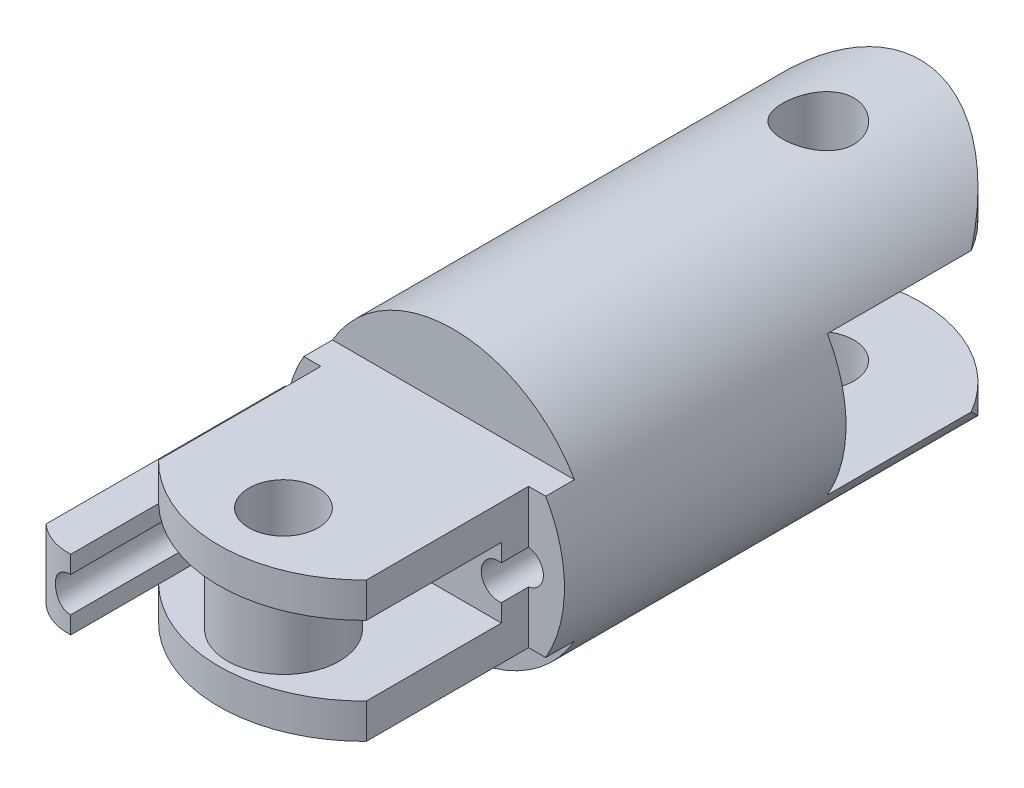
from build123d import *
from build123d.topology import SkipClean

# Parameters (mm, degrees)
SKETCH2_R                       = 10
PHALANGE_LENGTH_DEPTH           = 22.1
BOSS_EXTRUDE3_DEPTH             = 5
BOSS_EXTRUDE4_DEPTH             = 5
BOSS_EXTRUDE4_DEPTH_BACK        = 5
CUT_EXTRUDE2_START              = -15.3025
CUT_EXTRUDE2_DEPTH              = 15.3025
SKETCH7_R                       = 1.65
CUT_EXTRUDE3_DEPTH              = 10
CUT_EXTRUDE4_DEPTH              = 2.5
CUT_EXTRUDE4_DEPTH_BACK         = 2.5
CUT_EXTRUDE7_REACH              = 43.565
SKETCH4_R                       = 1.65
CUT_EXTRUDE7_DIRECTION_2_REACH  = 43.565
CUT_EXTRUDE_THIN1_START         = 22.1
CUT_EXTRUDE_THIN1_DEPTH         = 10.361670454
BOSS_EXTRUDE5_REACH             = 42.73
SKETCH9_R                       = 4
SKETCH9_R_2                     = 1.65
CUT_EXTRUDE8_REACH              = 41.987
SKETCH10_R                      = 1.25
CUT_EXTRUDE9_START              = -4
CUT_EXTRUDE9_DEPTH              = 4
CUT_EXTRUDE10_REACH             = 42.73
CUT_EXTRUDE10_DIRECTION_2_REACH = 42.73
CUT_EXTRUDE11_START             = -10
CUT_EXTRUDE11_OUTLINE_W         = 2.565773848
CUT_EXTRUDE11_OUTLINE_H         = 11.6166929
CUT_EXTRUDE11_DEPTH             = 10
BOSS_EXTRUDE7_REACH             = 40.388
CUT_EXTRUDE12_REACH             = 41.987
SKETCH10_2_R                    = 1.25
CUT_EXTRUDE12_DIRECTION_2_REACH = 41.987
SKETCH17_R                      = 1.25
SKETCH17_W                      = 2.42123439
SKETCH17_H                      = 5
CUT_EXTRUDE14_DEPTH             = 16.148519
SCALE1_SCALE                    = 0.666666667
CUT_EXTRUDE15_START             = -10
SKETCH18_R                      = 1.65
CUT_EXTRUDE15_DEPTH             = 13.333338
CUT_EXTRUDE16_START             = -3.333333
SKETCH19_R                      = 1.7
CUT_EXTRUDE16_DEPTH             = 13.333338


# Read off the part's stored shape, not the designer's step: Cut-Extrude-Thin1, Cut-Extrude11
with BuildPart() as part:
    # Sketch2 → Phalange Length (new body)
    with BuildSketch(Plane.XY):
        Circle(SKETCH2_R)
    extrude(amount=PHALANGE_LENGTH_DEPTH)

    # Sketch3 → Boss-Extrude3 (add)
    with BuildSketch(Plane(origin=(0, -10, 0), x_dir=(-1, 0, 0), z_dir=(0, -1, 0))):
        with BuildLine():
            Line((-10, 5.302499701), (-10, 0))
            Line((-10, 0), (10, 0))
            Line((10, 0), (10, 5.302499701))
            ThreePointArc((10, 5.302499701), (0, 15.302499701), (-10, 5.302499701))
        make_face()
    boss_extrude3 = extrude(amount=-BOSS_EXTRUDE3_DEPTH)

    # Mirror1: Boss-Extrude3 across plane
    add(boss_extrude3.mirror(Plane.ZX))

    # Sketch5 → Boss-Extrude4 (add, two sides: drawn at the far end of the back side and taken through both)
    with BuildSketch(Plane(origin=(0, 0, 0), x_dir=(1, 0, 0), z_dir=(0, 1, 0)).offset(-BOSS_EXTRUDE4_DEPTH_BACK)):
        with BuildLine():
            Line((-10, -27.883157911), (-10, -22.1))
            Line((-10, -22.1), (10, -22.1))
            Line((10, -22.1), (10, -27.883157911))
            ThreePointArc((10, -27.883157911), (0, -37.451984156), (-10, -27.883157911))
        make_face()
    extrude(amount=BOSS_EXTRUDE4_DEPTH + BOSS_EXTRUDE4_DEPTH_BACK)

    # Sketch6 → Cut-Extrude2 (cut)
    with SkipClean():  # the faces are left unmerged after this step: merging them gives an invalid solid
        with BuildSketch(Plane.XY.offset(CUT_EXTRUDE2_START)):
            with BuildLine():
                ThreePointArc((0, 10), (5, 8.660254038), (8.660254038, 5))
                Line((8.660254038, 5), (10, 5))
                Line((10, 5), (10, 10))
                Line((10, 10), (0, 10))
            make_face()
            with BuildLine():
                Line((10, -5), (8.660254038, -5))
                ThreePointArc((8.660254038, -5), (5, -8.660254038), (0, -10))
                Line((0, -10), (10, -10))
                Line((10, -10), (10, -5))
            make_face()
            with BuildLine():
                ThreePointArc((-8.660254038, 5), (-5, 8.660254038), (0, 10))
                Line((0, 10), (-10, 10))
                Line((-10, 10), (-10, 5))
                Line((-10, 5), (-8.660254038, 5))
            make_face()
            with BuildLine():
                Line((-10, -10), (0, -10))
                ThreePointArc((0, -10), (-5, -8.660254038), (-8.660254038, -5))
                Line((-8.660254038, -5), (-10, -5))
                Line((-10, -5), (-10, -10))
            make_face()
        extrude(amount=CUT_EXTRUDE2_DEPTH, mode=Mode.SUBTRACT)

    # Sketch7 → Cut-Extrude3 (cut)
    with SkipClean():  # the faces are left unmerged after this step: merging them gives an invalid solid
        with BuildSketch(Plane(origin=(0, 5, 0), x_dir=(1, 0, 0), z_dir=(0, 1, 0))):
            with Locations(Location((0, -30.261984156, 0), (0, 0, 270))):
                Circle(SKETCH7_R)
        extrude(amount=-CUT_EXTRUDE3_DEPTH, mode=Mode.SUBTRACT)

    # Sketch5<2> → Cut-Extrude4 (cut, two sides: drawn at the far end of the back side and taken through both)
    with BuildSketch(Plane(origin=(0, 0, 0), x_dir=(1, 0, 0), z_dir=(0, 1, 0)).offset(-CUT_EXTRUDE4_DEPTH_BACK)):
        with BuildLine():
            Line((-10, -27.883157911), (-10, -22.1))
            Line((-10, -22.1), (10, -22.1))
            Line((10, -22.1), (10, -27.883157911))
            ThreePointArc((10, -27.883157911), (0, -37.451984156), (-10, -27.883157911))
        make_face()
    extrude(amount=CUT_EXTRUDE4_DEPTH + CUT_EXTRUDE4_DEPTH_BACK, mode=Mode.SUBTRACT)

    # Sketch4 → Cut-Extrude7 (cut, up to next)
    with BuildSketch(Plane(origin=(0, -5, 0), x_dir=(1, 0, 0), z_dir=(0, 1, 0)), mode=Mode.PRIVATE) as cut_extrude7_sk1:
        with Locations(Location((0, 8.010159673, 0), (0, 0, 270))):
            Circle(SKETCH4_R)
    cut_extrude7_tool1 = extrude(cut_extrude7_sk1.sketch, amount=-CUT_EXTRUDE7_REACH, mode=Mode.PRIVATE) & part.part
    add(cut_extrude7_tool1.solids().sort_by_distance((0, -5, -8.01016))[0], mode=Mode.SUBTRACT)

    # Sketch4 → Cut-Extrude7 direction 2 (cut, up to next)
    with BuildSketch(Plane(origin=(0, -5, 0), x_dir=(1, 0, 0), z_dir=(0, 1, 0)), mode=Mode.PRIVATE) as cut_extrude7_direction_2_sk1:
        with Locations(Location((0, 8.010159673, 0), (0, 0, 270))):
            Circle(SKETCH4_R)
    cut_extrude7_direction_2_tool1 = extrude(cut_extrude7_direction_2_sk1.sketch, amount=CUT_EXTRUDE7_DIRECTION_2_REACH, mode=Mode.PRIVATE) & part.part
    add(cut_extrude7_direction_2_tool1.solids().sort_by_distance((0, -5, -8.01016))[0], mode=Mode.SUBTRACT)

    # Cut-Extrude-Thin1 outline → Cut-Extrude-Thin1 (cut)
    with SkipClean():  # the faces are left unmerged after this step: merging them gives an invalid solid
        with BuildSketch(Plane.XY.offset(CUT_EXTRUDE_THIN1_START)):
            with BuildLine():
                ThreePointArc((8.660254038, 5), (9.256147934, 3.78466979), (9.682458366, 2.5))
                Line((9.682458366, 2.5), (10, 2.5))
                Line((10, 2.5), (10, 5))
                Line((10, 5), (8.660254038, 5))
            make_face()
            with BuildLine():
                Line((10, -2.5), (9.682458366, -2.5))
                ThreePointArc((9.682458366, -2.5), (9.256147934, -3.78466979), (8.660254038, -5))
                Line((8.660254038, -5), (10, -5))
                Line((10, -5), (10, -2.5))
            make_face()
            with BuildLine():
                Line((-10, 2.5), (-9.682458366, 2.5))
                ThreePointArc((-9.682458366, 2.5), (-9.256147934, 3.78466979), (-8.660254038, 5))
                Line((-8.660254038, 5), (-10, 5))
                Line((-10, 5), (-10, 2.5))
            make_face()
            with BuildLine():
                ThreePointArc((-8.660254038, -5), (-9.256147934, -3.78466979), (-9.682458366, -2.5))
                Line((-9.682458366, -2.5), (-10, -2.5))
                Line((-10, -2.5), (-10, -5))
                Line((-10, -5), (-8.660254038, -5))
            make_face()
        extrude(amount=CUT_EXTRUDE_THIN1_DEPTH, mode=Mode.SUBTRACT)

    # Sketch9 → Boss-Extrude5 (add, up to next)
    with BuildSketch(Plane.XZ.offset(-2.5), mode=Mode.PRIVATE) as boss_extrude5_sk1:
        with Locations(Location((0, 30.261984156, 0), (0, 0, 90))):
            Circle(SKETCH9_R)
        with Locations(Location((0, 30.261984156, 0), (0, 0, 90))):
            Circle(SKETCH9_R_2, mode=Mode.SUBTRACT)
    boss_extrude5_tool1 = extrude(boss_extrude5_sk1.sketch, amount=BOSS_EXTRUDE5_REACH, mode=Mode.PRIVATE) - part.part
    add(boss_extrude5_tool1.solids().sort_by_distance((0, 2.5, 26.375121))[0])

    # Sketch10 → Cut-Extrude8 (cut, up to next)
    with BuildSketch(Plane.XY.offset(22.1), mode=Mode.PRIVATE) as cut_extrude8_sk1:
        with Locations((7.239961745, 0)):
            Circle(SKETCH10_R)
    cut_extrude8_tool1 = extrude(cut_extrude8_sk1.sketch, amount=-CUT_EXTRUDE8_REACH, mode=Mode.PRIVATE) & part.part
    # Sketch10 → Cut-Extrude8 (cut, up to next)
    with BuildSketch(Plane.XY.offset(22.1), mode=Mode.PRIVATE) as cut_extrude8_sk2:
        with Locations((-7.239961745, 0)):
            Circle(SKETCH10_R)
    cut_extrude8_tool2 = extrude(cut_extrude8_sk2.sketch, amount=-CUT_EXTRUDE8_REACH, mode=Mode.PRIVATE) & part.part
    add(cut_extrude8_tool1.solids().sort_by_distance((7.239962, 0, 22.1))[0], mode=Mode.SUBTRACT)
    add(cut_extrude8_tool2.solids().sort_by_distance((-7.239962, 0, 22.1))[0], mode=Mode.SUBTRACT)

    # Sketch11 → Cut-Extrude9 (cut)
    with SkipClean():  # the faces are left unmerged after this step: merging them gives an invalid solid
        with BuildSketch(Plane.XY.offset(22.1).offset(CUT_EXTRUDE9_START)):
            with BuildLine():
                ThreePointArc((8.660254038, 5), (0, 10), (-8.660254038, 5))
                Line((-8.660254038, 5), (8.660254038, 5))
            make_face()
            with BuildLine():
                Line((8.660254038, -5), (-8.660254038, -5))
                ThreePointArc((-8.660254038, -5), (0, -10), (8.660254038, -5))
            make_face()
        extrude(amount=CUT_EXTRUDE9_DEPTH, mode=Mode.SUBTRACT)

    # Sketch12 → Cut-Extrude10 (cut, up to next)
    with BuildSketch(Plane.XZ.offset(-2.5), mode=Mode.PRIVATE) as cut_extrude10_sk1:
        with BuildLine():
            Line((-10.033719202, 37.451984156), (-10.033719202, 30.264892021))
            Line((-10.033719202, 30.264892021), (-8.660254038, 30.264892021))
            ThreePointArc((-8.660254038, 30.264892021), (0, 34.890740593), (8.660254038, 30.264892021))
            Line((8.660254038, 30.264892021), (10.033719202, 30.264892021))
            Line((10.033719202, 30.264892021), (10.033719202, 37.451984156))
            Line((10.033719202, 37.451984156), (-10.033719202, 37.451984156))
        make_face()
    cut_extrude10_tool1 = extrude(cut_extrude10_sk1.sketch, amount=CUT_EXTRUDE10_REACH, mode=Mode.PRIVATE) & part.part
    add(cut_extrude10_tool1.solids().sort_by_distance((0, 2.5, 34.950279))[0], mode=Mode.SUBTRACT)

    # Sketch12 → Cut-Extrude10 direction 2 (cut, up to next)
    with BuildSketch(Plane.XZ.offset(-2.5), mode=Mode.PRIVATE) as cut_extrude10_direction_2_sk1:
        with BuildLine():
            Line((-10.033719202, 37.451984156), (-10.033719202, 30.264892021))
            Line((-10.033719202, 30.264892021), (-8.660254038, 30.264892021))
            ThreePointArc((-8.660254038, 30.264892021), (0, 34.890740593), (8.660254038, 30.264892021))
            Line((8.660254038, 30.264892021), (10.033719202, 30.264892021))
            Line((10.033719202, 30.264892021), (10.033719202, 37.451984156))
            Line((10.033719202, 37.451984156), (-10.033719202, 37.451984156))
        make_face()
    cut_extrude10_direction_2_tool1 = extrude(cut_extrude10_direction_2_sk1.sketch, amount=-CUT_EXTRUDE10_DIRECTION_2_REACH, mode=Mode.PRIVATE) & part.part
    add(cut_extrude10_direction_2_tool1.solids().sort_by_distance((0, 2.5, 34.950279))[0], mode=Mode.SUBTRACT)

    # Cut-Extrude11 outline → Cut-Extrude11 (cut)
    with BuildSketch(Plane.XZ.offset(5).offset(CUT_EXTRUDE11_START)):
        with Locations((-8.717113076, 25.960571369)):
            Rectangle(CUT_EXTRUDE11_OUTLINE_W, CUT_EXTRUDE11_OUTLINE_H)
        with Locations((8.717113076, 25.960571369)):
            Rectangle(CUT_EXTRUDE11_OUTLINE_W, CUT_EXTRUDE11_OUTLINE_H)
    extrude(amount=CUT_EXTRUDE11_DEPTH, mode=Mode.SUBTRACT)

    # Boss-Extrude7: up to this face of the body (flat: up to its plane)
    boss_extrude7_end = Plane(part.part.faces().sort_by_distance((0, 2.5, 22.296174341))[0])
    # Sketch16 → Boss-Extrude7 (add, up to the picked face)
    with BuildSketch(Plane(origin=(0, -2.5, 0), x_dir=(1, 0, 0), z_dir=(0, 1, 0)), mode=Mode.PRIVATE) as boss_extrude7_sk1:
        with BuildLine():
            Line((-4.818727355, -20.152224919), (-7.434226152, -20.152224919))
            Line((-7.434226152, -20.152224919), (-10, -20.152224919))
            Line((-10, -20.152224919), (-10, -37.258561033))
            ThreePointArc((-10, -37.258561033), (-8.808295471, -37.990817912), (-7.43422564, -38.252145139))
            ThreePointArc((-7.43422564, -38.252145139), (-6.033645007, -37.999721533), (-4.818727355, -37.258561033))
            Line((-4.818727355, -37.258561033), (-4.818727355, -33.709527951))
            ThreePointArc((-4.818727355, -33.709527951), (-6.204248493, -32.842230104), (-7.437080645, -31.768917819))
            Line((-7.437080645, -31.768917819), (-7.434226152, -31.768917819))
            Line((-7.434226152, -31.768917819), (-7.434226152, -22.1))
            Line((-7.434226152, -22.1), (-4.818727355, -22.1))
            Line((-4.818727355, -22.1), (-4.818727355, -20.152224919))
        make_face()
    boss_extrude7_tool1 = split(extrude(boss_extrude7_sk1.sketch, amount=BOSS_EXTRUDE7_REACH, mode=Mode.PRIVATE), bisect_by=boss_extrude7_end, keep=Keep.BOTH, mode=Mode.PRIVATE)
    # Sketch16 → Boss-Extrude7 (add, up to the picked face)
    with BuildSketch(Plane(origin=(0, -2.5, 0), x_dir=(1, 0, 0), z_dir=(0, 1, 0)), mode=Mode.PRIVATE) as boss_extrude7_sk2:
        with BuildLine():
            Line((-4.818727355, -33.709527951), (-4.818727355, -22.1))
            Line((-4.818727355, -22.1), (-7.434226152, -22.1))
            Line((-7.434226152, -22.1), (-7.434226152, -31.768917819))
            Line((-7.434226152, -31.768917819), (-7.437080645, -31.768917819))
            ThreePointArc((-7.437080645, -31.768917819), (-6.204248493, -32.842230104), (-4.818727355, -33.709527951))
        make_face()
    boss_extrude7_tool2 = split(extrude(boss_extrude7_sk2.sketch, amount=BOSS_EXTRUDE7_REACH, mode=Mode.PRIVATE), bisect_by=boss_extrude7_end, keep=Keep.BOTH, mode=Mode.PRIVATE)
    add(boss_extrude7_tool1.solids().sort_by(Axis((-7.989429, -2.5, 29.733344), (0, 1, 0)))[0])
    add(boss_extrude7_tool2.solids().sort_by(Axis((-6.08748, -2.5, 27.4879), (0, 1, 0)))[0])

    # Sketch10<2> → Cut-Extrude12 (cut, up to next)
    with BuildSketch(Plane.XY.offset(22.1), mode=Mode.PRIVATE) as cut_extrude12_sk1:
        with Locations((-7.239961745, 0)):
            Circle(SKETCH10_2_R)
    cut_extrude12_tool1 = extrude(cut_extrude12_sk1.sketch, amount=CUT_EXTRUDE12_REACH, mode=Mode.PRIVATE) & part.part
    add(cut_extrude12_tool1.solids().sort_by_distance((-7.239962, 0, 22.1))[0], mode=Mode.SUBTRACT)

    # Sketch10<2> → Cut-Extrude12 direction 2 (cut, up to next)
    with BuildSketch(Plane.XY.offset(22.1), mode=Mode.PRIVATE) as cut_extrude12_direction_2_sk1:
        with Locations((-7.239961745, 0)):
            Circle(SKETCH10_2_R)
    cut_extrude12_direction_2_tool1 = extrude(cut_extrude12_direction_2_sk1.sketch, amount=-CUT_EXTRUDE12_DIRECTION_2_REACH, mode=Mode.PRIVATE) & part.part
    add(cut_extrude12_direction_2_tool1.solids().sort_by_distance((-7.239962, 0, 22.1))[0], mode=Mode.SUBTRACT)

    # Sketch17 → Cut-Extrude14 (cut)
    with SkipClean():  # the faces are left unmerged after this step: merging them gives an invalid solid
        with BuildSketch(Plane.XY.offset(22.1)):
            with Locations((-7.239961745, 0)):
                Circle(SKETCH17_R)
            with Locations((-6.02934455, 0)):
                Rectangle(SKETCH17_W, SKETCH17_H)
        extrude(amount=CUT_EXTRUDE14_DEPTH, mode=Mode.SUBTRACT)


with BuildPart() as part_1:
    # Scale1: scaled about (-0.194054701, -1.77e-07, 9.487138568)
    add(part.part.scale(SCALE1_SCALE).moved(Location((-0.0646849, -5.9e-08, 3.162379523))))

    # Sketch18 → Cut-Extrude15 (cut)
    with BuildSketch(Plane(origin=(0, 3.333328714, 0), x_dir=(1, 0, 0), z_dir=(0, 1, 0)).offset(CUT_EXTRUDE15_START)):
        with Locations(Location((-0.064694214, -23.337201464, 0), (0, 0, 270))):
            Circle(SKETCH18_R)
    extrude(amount=CUT_EXTRUDE15_DEPTH, mode=Mode.SUBTRACT)

    # Sketch19 → Cut-Extrude16 (cut)
    with BuildSketch(Plane(origin=(0, -3.333337953, 0), x_dir=(1, 0, 0), z_dir=(0, 1, 0)).offset(CUT_EXTRUDE16_START)):
        with Locations(Location((-0.064694214, 2.177561088, 0), (0, 0, 90))):
            Circle(SKETCH19_R)
    extrude(amount=CUT_EXTRUDE16_DEPTH, mode=Mode.SUBTRACT)


solid = part_1.part
